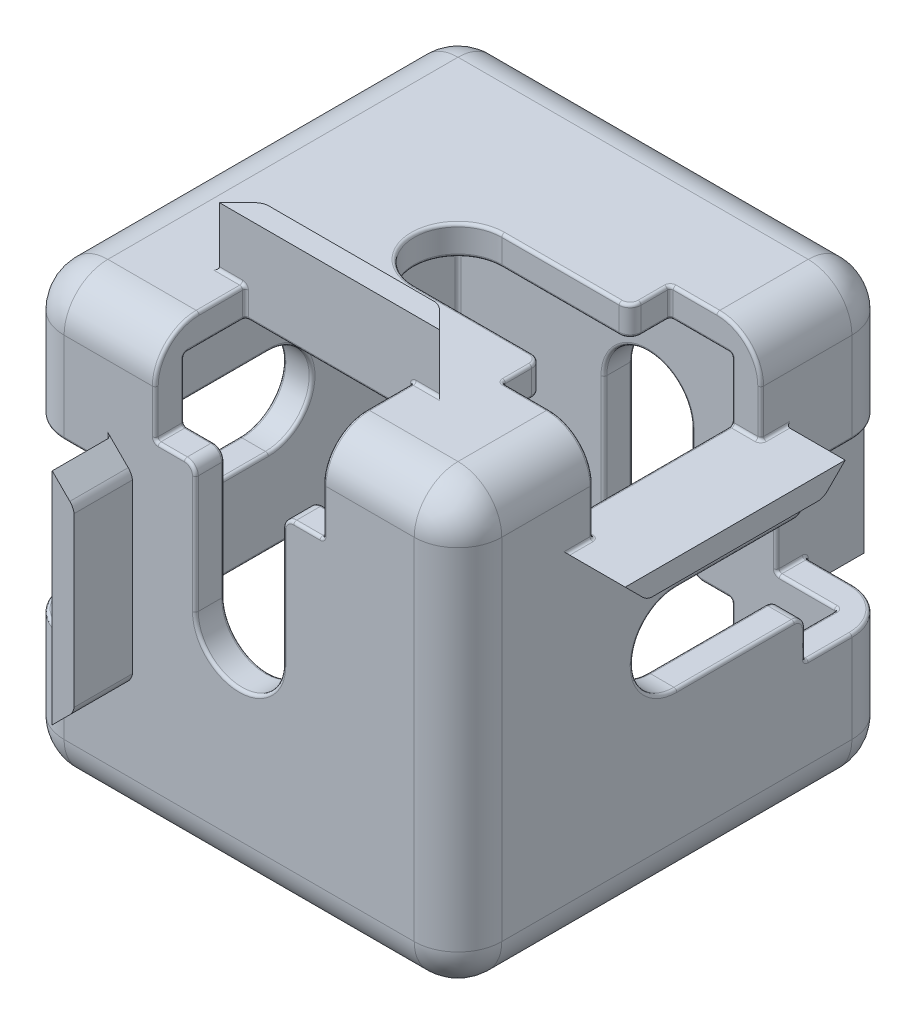
from build123d import *

# Parameters (mm, degrees)
SKETCH1_W           = 30
SKETCH1_H           = 30
EXTRUDE1_DEPTH      = 30
SHELL1_T            = 2
FILLET1_R           = 3
SKETCH3_W           = 11.5
SKETCH3_H           = 7.6875
EXTRUDE3_DEPTH      = 3
CIRPATTERN3_COUNT   = 3
EXTRUDE4_START      = -3
SKETCH4_W           = 11.5
SKETCH4_H           = 7.6875
EXTRUDE4_DEPTH      = 3
CIRPATTERN4_COUNT   = 3
EXTRUDE9_DEPTH      = 6
CIRPATTERN5_START   = -19
CIRPATTERN5_DEPTH   = 6
CIRPATTERN5_2_DEPTH = 6
EXTRUDE10_DEPTH     = 6
CIRPATTERN6_START   = -4
CIRPATTERN6_DEPTH   = 6
CIRPATTERN6_START_2 = 13
CIRPATTERN6_2_DEPTH = 6
FILLET6_R           = 0.75
FILLET7_R           = 0.2


# Read off the part's stored shape, not the designer's step: CirPattern5, CirPattern6
with BuildPart() as part:
    # Sketch1 → Extrude1 (new body)
    with BuildSketch(Plane(origin=(0, 0, 0), x_dir=(1, 0, 0), z_dir=(0, 1, 0))):
        Rectangle(SKETCH1_W, SKETCH1_H)
    extrude(amount=EXTRUDE1_DEPTH)

    # Shell1 (no face opened: a closed hollow body)
    add(offset(amount=-SHELL1_T, mode=Mode.PRIVATE), mode=Mode.SUBTRACT)

    # Fillet1
    fillet1_edges = [part.edges().sort_by_distance(p)[0] for p in [
        (-15, 30, 0),
        (0, 30, 15),
        (15, 30, 0),
        (0, 0, 15),
        (-15, 0, 0),
        (0, 0, -15),
        (15, 0, 0),
        (0, 30, -15),
        (15, 15, 15),
        (-15, 15, 15),
        (-15, 15, -15),
        (15, 15, -15),
    ]]
    fillet(fillet1_edges, radius=FILLET1_R)

    # Sketch3 → Extrude3 (cut)
    with BuildSketch(Plane.ZY.offset(15)):
        with Locations((0, 3.84375)):
            Rectangle(SKETCH3_W, SKETCH3_H)
        with BuildLine():
            Line((8.8, 12), (8.8, 9.25))
            Line((8.8, 9.25), (15, 9.25))
            Line((15, 9.25), (15, 20.75))
            Line((15, 20.75), (8.8, 20.75))
            Line((8.8, 20.75), (8.8, 18))
            Line((8.8, 18), (0, 18))
            ThreePointArc((0, 18), (-3, 15), (0, 12))
            Line((0, 12), (8.8, 12))
        make_face()
    extrude3 = extrude(amount=-EXTRUDE3_DEPTH, mode=Mode.SUBTRACT)

    # CirPattern3: Extrude3 ×3 about axis
    cirpattern3_axis = Axis((5, 10, 5), (0.5773502691896257, -0.5773502691896257, 0.5773502691896257))
    for i in range(1, CIRPATTERN3_COUNT):
        add(extrude3.rotate(cirpattern3_axis, i * 360 / CIRPATTERN3_COUNT), mode=Mode.SUBTRACT)

    # Sketch4 → Extrude4 (cut)
    with BuildSketch(Plane(origin=(15, 0, 0), x_dir=(0, 0, -1), z_dir=(1, 0, 0)).offset(EXTRUDE4_START)):
        with BuildLine():
            Line((8.8, 9.25), (15, 9.25))
            Line((15, 9.25), (15, 20.75))
            Line((15, 20.75), (8.8, 20.75))
            Line((8.8, 20.75), (8.8, 18))
            Line((8.8, 18), (0, 18))
            ThreePointArc((0, 18), (-3, 15.000000282), (-5.63e-07, 12))
            Line((-5.63e-07, 12), (8.8, 12))
            Line((8.8, 12), (8.8, 9.25))
        make_face()
        with Locations((0, 26.15625)):
            Rectangle(SKETCH4_W, SKETCH4_H)
    extrude4 = extrude(amount=EXTRUDE4_DEPTH, mode=Mode.SUBTRACT)

    # CirPattern4: Extrude4 ×3 about axis
    cirpattern4_axis = Axis((5, 10, 5), (0.5773502691896257, -0.5773502691896257, 0.5773502691896257))
    for i in range(1, CIRPATTERN4_COUNT):
        add(extrude4.rotate(cirpattern4_axis, i * 360 / CIRPATTERN4_COUNT), mode=Mode.SUBTRACT)

    # Sketch14 → Extrude9 (add)
    with BuildSketch(Plane.XZ.offset(-28)):
        with BuildLine():
            Line((-5.75, 7.3125), (5.75, 7.3125))
            ThreePointArc((5.75, 7.3125), (6.064901369, 7.41200156), (6.332601013, 7.605393219))
            Line((6.332601013, 7.605393219), (7.539707794, 8.8125))
            Line((7.539707794, 8.8125), (-7.539707794, 8.8125))
            Line((-7.539707794, 8.8125), (-6.332601013, 7.605393219))
            ThreePointArc((-6.332601013, 7.605393219), (-6.064901369, 7.41200156), (-5.75, 7.3125))
        make_face()
    extrude(amount=-EXTRUDE9_DEPTH)

    # CirPattern5 outline → CirPattern5 (add)
    with BuildSketch(Plane.XY.offset(CIRPATTERN5_START)):
        with BuildLine():
            Line((8.8125, 22.539707794), (7.605393219, 21.332601013))
            ThreePointArc((7.605393219, 21.332601013), (7.41200156, 21.064901369), (7.3125, 20.75))
            Line((7.3125, 20.75), (7.3125, 9.25))
            ThreePointArc((7.3125, 9.25), (7.41200156, 8.935098631), (7.605393219, 8.667398987))
            Line((7.605393219, 8.667398987), (8.8125, 7.460292206))
            Line((8.8125, 7.460292206), (8.8125, 22.539707794))
        make_face()
    extrude(amount=CIRPATTERN5_DEPTH)

    # CirPattern5 2 outline → CirPattern5 2 (add)
    with BuildSketch(Plane.YZ.offset(CIRPATTERN5_START)):
        with BuildLine():
            Line((6.1875, -7.539707794), (7.394606781, -6.332601013))
            ThreePointArc((7.394606781, -6.332601013), (7.58799844, -6.064901369), (7.6875, -5.75))
            Line((7.6875, -5.75), (7.6875, 5.75))
            ThreePointArc((7.6875, 5.75), (7.58799844, 6.064901369), (7.394606781, 6.332601013))
            Line((7.394606781, 6.332601013), (6.1875, 7.539707794))
            Line((6.1875, 7.539707794), (6.1875, -7.539707794))
        make_face()
    extrude(amount=CIRPATTERN5_2_DEPTH)

    # Sketch16 → Extrude10 (add)
    with BuildSketch(Plane.ZY.offset(-13)):
        with BuildLine():
            Line((-5.75, 22.3125), (5.75, 22.3125))
            ThreePointArc((5.75, 22.3125), (6.064901369, 22.41200156), (6.332601013, 22.605393219))
            Line((6.332601013, 22.605393219), (7.539707794, 23.8125))
            Line((7.539707794, 23.8125), (-7.539707794, 23.8125))
            Line((-7.539707794, 23.8125), (-6.332601013, 22.605393219))
            ThreePointArc((-6.332601013, 22.605393219), (-6.064901369, 22.41200156), (-5.75, 22.3125))
        make_face()
    extrude(amount=-EXTRUDE10_DEPTH)

    # CirPattern6 outline → CirPattern6 (add)
    with BuildSketch(Plane(origin=(0, 0, 0), x_dir=(1, 0, 0), z_dir=(0, 1, 0)).offset(CIRPATTERN6_START)):
        with BuildLine():
            Line((-7.539707794, 8.8125), (-6.332601013, 7.605393219))
            ThreePointArc((-6.332601013, 7.605393219), (-6.064901369, 7.41200156), (-5.75, 7.3125))
            Line((-5.75, 7.3125), (5.75, 7.3125))
            ThreePointArc((5.75, 7.3125), (6.064901369, 7.41200156), (6.332601013, 7.605393219))
            Line((6.332601013, 7.605393219), (7.539707794, 8.8125))
            Line((7.539707794, 8.8125), (-7.539707794, 8.8125))
        make_face()
    extrude(amount=CIRPATTERN6_DEPTH)

    # CirPattern6 2 outline → CirPattern6 2 (add)
    with BuildSketch(Plane.XY.offset(CIRPATTERN6_START_2)):
        with BuildLine():
            ThreePointArc((-7.3125, 20.75), (-7.41200156, 21.064901369), (-7.605393219, 21.332601013))
            Line((-7.605393219, 21.332601013), (-8.8125, 22.539707794))
            Line((-8.8125, 22.539707794), (-8.8125, 7.460292206))
            Line((-8.8125, 7.460292206), (-7.605393219, 8.667398987))
            ThreePointArc((-7.605393219, 8.667398987), (-7.41200156, 8.935098631), (-7.3125, 9.25))
            Line((-7.3125, 9.25), (-7.3125, 20.75))
        make_face()
    extrude(amount=CIRPATTERN6_2_DEPTH)

    # Fillet6
    fillet6_edges = [part.edges().sort_by_distance(p)[0] for p in [
        (3, 6.2, -14),
        (-3, 6.2, -14),
        (8.8, 29, 3),
        (8.8, 29, -3),
        (14, 12, -8.8),
        (14, 18, -8.8),
        (3, 23.8, 14),
        (-3, 23.8, 14),
        (-8.8, 1, 3),
        (-8.8, 1, -3),
        (-14, 12, 8.8),
        (-14, 18, 8.8),
    ]]
    fillet(fillet6_edges, radius=FILLET6_R)

    # Fillet7
    fillet7_edges = [part.edges().sort_by_distance(p)[0] for p in [
        (-13, 2, 9.375),
        (-10.9, 2, -5.75),
        (-10.9, 2, 5.75),
        (-15, 4.59375, 5.75),
        (-14.121320344, 0.878679656, 5.75),
        (-14.121320344, 0.878679656, -5.75),
        (-13, 4.09375, -5.75),
        (-9.375, 2, -13),
        (5.75, 2, -10.90625),
        (4.75, 6.2, -13),
        (0, 18, -13),
        (-3, 10.975, -13),
        (5.75, 4.6, -15),
        (-5.75, 4.6, -15),
        (13, 2, 0),
        (-4.75, 6.2, -15),
        (0, 18, -15),
        (3, 10.975, -15),
        (13, 15, 13),
        (9.375, 2, -13),
        (13, 24.375, -13),
        (-13, 2, -9.375),
        (-5.75, 0.878679656, -14.121320344),
        (-5.75, 4.1, -13),
        (5.75, 0.878679656, -14.121320344),
        (5.75, 4.1, -13),
        (-13, 15, -13),
        (0, 2, 13),
        (-5.75, 6.2, -14),
        (5.75, 6.2, -14),
        (-13, 24.375, 13),
        (13, 28, 9.375),
        (0, 28, -13),
        (-13, 28, 0),
        (-9.375, 28, 13),
        (13, 5.625, -13),
        (10.90625, 20.75, -13),
        (14.121320344, 9.25, -14.121320344),
        (13, 9.25, -10.9),
        (14.121320344, 20.75, -14.121320344),
        (13, 20.75, -10.9),
        (10.40625, 9.25, -15),
        (13, 28, -9.375),
        (8.8, 28, 4.75),
        (10.9, 28, 5.75),
        (-3, 28, 0),
        (4.025, 28, -3),
        (10.9, 28, -5.75),
        (14.121320344, 29.121320344, -5.75),
        (13, 25.90625, -5.75),
        (14.121320344, 29.121320344, 5.75),
        (8.8, 29, -5.75),
        (8.8, 29, 5.75),
        (10.4, 30, -5.75),
        (8.8, 30, -4.75),
        (-3, 30, 0),
        (4.025, 30, 3),
        (10.4, 30, 5.75),
        (9.375, 28, 13),
        (-5.75, 28, 10.90625),
        (5.75, 29.121320344, 14.121320344),
        (5.75, 25.9, 13),
        (-5.75, 29.121320344, 14.121320344),
        (-5.75, 25.9, 13),
        (5.75, 30, 10.40625),
        (13, 18, -4.025),
        (13, 15.000000282, 3),
        (13, 10.25, -8.8),
        (14, 20.75, -8.8),
        (14, 9.25, -8.8),
        (15, 20.75, -10.4),
        (15, 19.75, -8.8),
        (15, 15.000000282, 3),
        (15, 12, -4.024999718),
        (15, 9.25, -10.4),
        (15, 25.40625, 5.75),
        (-3, 19.025, 13),
        (-2.82e-07, 12, 13),
        (4.75, 23.8, 13),
        (-5.75, 23.8, 14),
        (5.75, 23.8, 14),
        (-5.75, 25.4, 15),
        (-4.75, 23.8, 15),
        (-2.82e-07, 12, 15),
        (3, 19.024999718, 15),
        (5.75, 25.4, 15),
        (-10.40625, 9.25, 15),
        (-8.8, 2, -4.75),
        (3, 2, -2.82e-07),
        (-4.024999718, 2, 3),
        (-8.8, 1, 5.75),
        (-8.8, 1, -5.75),
        (-10.4, 0, -5.75),
        (-8.8, 0, -4.75),
        (3, 0, -2.82e-07),
        (-4.024999718, 0, 3),
        (-10.4, 0, 5.75),
        (5.75, 0, -10.40625),
        (-5.75, 30, 10.40625),
        (-5.75, 29, 8.8125),
        (5.75, 28, 10.90625),
        (6.644853897, 30, 8.8125),
        (5.75, 29, 8.8125),
        (0, 28, 8.8125),
        (-6.644853897, 30, 8.8125),
        (10.40625, 20.75, -15),
        (8.8125, 20.75, -14),
        (10.90625, 9.25, -13),
        (8.8125, 8.355146103, -15),
        (8.8125, 9.25, -14),
        (8.8125, 15, -13),
        (8.8125, 21.644853897, -15),
        (-15, 4.59375, -5.75),
        (-14, 6.1875, -5.75),
        (-13, 4.09375, 5.75),
        (-15, 6.1875, 6.644853897),
        (-14, 6.1875, 5.75),
        (-13, 6.1875, 0),
        (-15, 6.1875, -6.644853897),
        (13, 25.90625, 5.75),
        (14, 23.8125, 5.75),
        (15, 25.40625, -5.75),
        (14, 23.8125, -5.75),
        (15, 23.8125, -6.644853897),
        (13, 23.8125, 0),
        (15, 23.8125, 6.644853897),
        (5.75, 1, -8.8125),
        (-5.75, 2, -10.90625),
        (-5.75, 0, -10.40625),
        (-5.75, 1, -8.8125),
        (0, 2, -8.8125),
        (-6.644853897, 0, -8.8125),
        (6.644853897, 0, -8.8125),
        (-10.90625, 9.25, 13),
        (-13, 5.625, 13),
        (-10.40625, 20.75, 15),
        (-8.8125, 20.75, 14),
        (-8.8125, 21.644853897, 15),
        (-8.8125, 15, 13),
        (-8.8125, 8.355146103, 15),
        (-8.8125, 9.25, 14),
        (-10.90625, 20.75, 13),
        (-13, 10.25, 8.8),
        (-13, 15, -3),
        (-13, 18, 4.025),
        (4.75, 6.2, -15),
        (-3, 10.975, -15),
        (-3.219669914, 6.419669914, -15),
        (3.219669914, 6.419669914, -15),
        (3, 10.975, -13),
        (-4.75, 6.2, -13),
        (-3.219669914, 6.419669914, -13),
        (3.219669914, 6.419669914, -13),
        (4.025, 30, -3),
        (8.8, 30, 4.75),
        (8.580330086, 30, 3.219669914),
        (8.580330086, 30, -3.219669914),
        (8.8, 28, -4.75),
        (4.025, 28, 3),
        (8.580330086, 28, 3.219669914),
        (8.580330086, 28, -3.219669914),
        (15, 18, -4.025),
        (15, 10.25, -8.8),
        (15, 11.780330086, -8.580330086),
        (15, 18.219669914, -8.580330086),
        (13, 19.75, -8.8),
        (13, 12, -4.024999718),
        (13, 11.780330086, -8.580330086),
        (13, 18.219669914, -8.580330086),
        (-3, 19.025, 15),
        (4.75, 23.8, 15),
        (3.219669914, 23.580330086, 15),
        (-3.219669914, 23.580330086, 15),
        (-4.75, 23.8, 13),
        (3, 19.024999718, 13),
        (3.219669914, 23.580330086, 13),
        (-3.219669914, 23.580330086, 13),
        (-15, 18, 4.025),
        (-15, 10.25, 8.8),
        (-15, 11.780330086, 8.580330086),
        (-15, 18.219669914, 8.580330086),
        (-13, 19.75, 8.8),
        (-13, 12, 4.025),
        (-13, 11.780330086, 8.580330086),
        (-13, 18.219669914, 8.580330086),
        (-8.8, 0, 4.75),
        (-8.8, 2, 4.75),
        (-4.025, 0, -3),
        (-8.580330086, 0, -3.219669914),
        (-8.580330086, 0, 3.219669914),
        (-4.025, 2, -3),
        (-8.580330086, 2, -3.219669914),
        (-8.580330086, 2, 3.219669914),
        (-15, 9.25, 10.4),
        (-15, 20.75, 10.4),
        (-15, 19.75, 8.8),
        (-15, 15, -3),
        (-15, 12, 4.025),
        (-14.121320344, 20.75, 14.121320344),
        (-13, 20.75, 10.9),
        (-14.121320344, 9.25, 14.121320344),
        (-13, 9.25, 10.9),
        (-14, 20.75, 8.8),
        (-14, 9.25, 8.8),
    ]]
    fillet(fillet7_edges, radius=FILLET7_R)


solid = part.part
